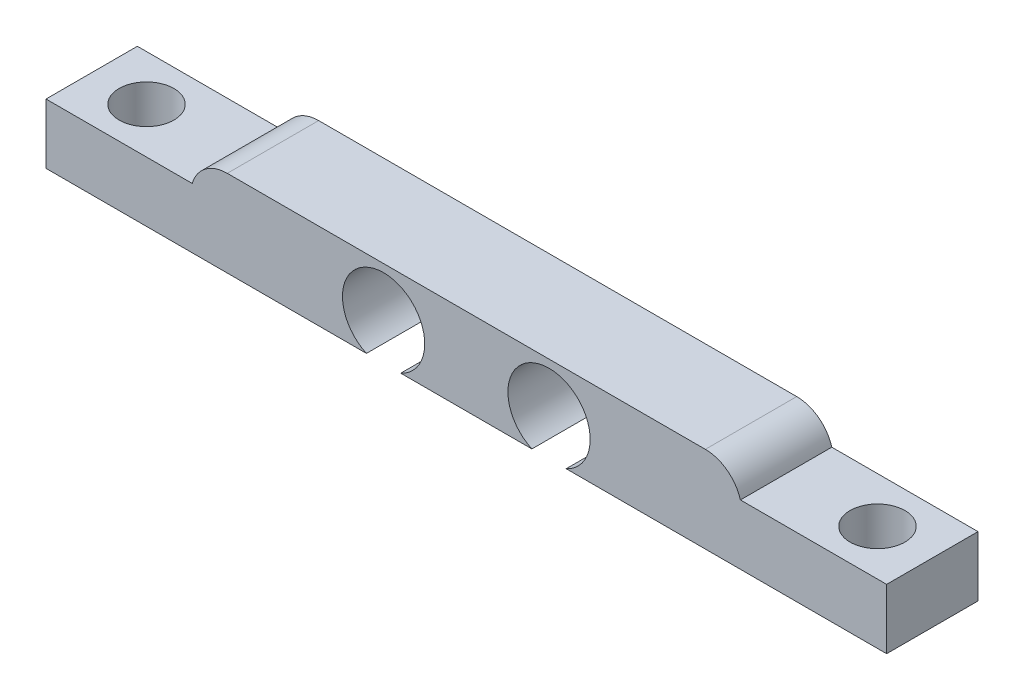
from build123d import *

# Parameters (mm, degrees)
BOSS_EXTRUDE1_DEPTH     = 5
FILLET1_R               = 2
CUT_EXTRUDE1_DEPTH      = 34.538204198
CUT_EXTRUDE1_DEPTH_BACK = 34.538204198
SKETCH2_R               = 1.5
CUT_EXTRUDE2_DEPTH      = 34.709745494
CUT_EXTRUDE2_DEPTH_BACK = 34.709745494
SKETCH3_R               = 2.25


with BuildPart() as part:
    # Sketch1 → Boss-Extrude1 (new body)
    with BuildSketch(Plane.XY):
        Polygon((-5, 4.727255151), (-5, 3.288029927), (-13, 3.288029927), (-13, 0), (33, 0), (33, 3.288029927), (25, 3.288029927), (25, 4.727255151), align=None)
    extrude(amount=-BOSS_EXTRUDE1_DEPTH)

    # Fillet1
    # the kernel refuses this fillet: 2 mm, written as the material it takes off along each edge
    with BuildSketch(Plane(origin=(-5, 4.727255151, 4.799434635), x_dir=(0, -1, 0), z_dir=(0, 0, -1))) as fillet1_piece_1:
        with BuildLine():
            CenterArc((2, -1.919773854), FILLET1_R, 106.283326604, 73.716673396)
            Line((0, -1.919773854), (-0.04, -1.919773854))
            Line((-0.04, -1.919773854), (-0.04, 0))
            Line((-0.04, 0), (0, 0.04))
            ThreePointArc((0, 0.04), (0.719612612, 0.04), (1.428009728, 0.038395477))
            Line((1.428009728, 0.038395477), (1.439225223, 0))
        make_face()
    extrude(amount=14.598869269, mode=Mode.SUBTRACT)
    with BuildSketch(Plane(origin=(25, 4.727255151, 4.799434635), x_dir=(0, -1, 0), z_dir=(0, 0, -1))) as fillet1_piece_2:
        with BuildLine():
            CenterArc((2, 1.919773854), FILLET1_R, 180, 73.716673396)
            Line((0, 1.919773854), (-0.04, 1.919773854))
            Line((-0.04, 1.919773854), (-0.04, 0))
            Line((-0.04, 0), (0, -0.04))
            ThreePointArc((0, -0.04), (0.719612612, -0.04), (1.428009728, -0.038395477))
            Line((1.428009728, -0.038395477), (1.439225223, 0))
        make_face()
    extrude(amount=14.598869269, mode=Mode.SUBTRACT)

    # Sketch2 → Cut-Extrude1 (cut, two sides: drawn at the far end of the back side and taken through both)
    with BuildSketch(Plane(origin=(0, 3.288029927, 0), x_dir=(1, 0, 0), z_dir=(0, 1, 0)).offset(-CUT_EXTRUDE1_DEPTH_BACK)):
        with Locations(Location((-10, 2.5, 0), (0, 0, 180))):
            Circle(SKETCH2_R)
        with Locations(Location((30, 2.5, 0), (0, 0, 180))):
            Circle(SKETCH2_R)
    extrude(amount=CUT_EXTRUDE1_DEPTH + CUT_EXTRUDE1_DEPTH_BACK, mode=Mode.SUBTRACT)

    # Sketch3 → Cut-Extrude2 (cut, two sides: drawn at the far end of the back side and taken through both)
    with BuildSketch(Plane.XY.offset(-CUT_EXTRUDE2_DEPTH_BACK)):
        with Locations((14.527125966, 2.045207178)):
            Circle(SKETCH3_R)
        with Locations((5.472874034, 2.045207178)):
            Circle(SKETCH3_R)
    extrude(amount=CUT_EXTRUDE2_DEPTH + CUT_EXTRUDE2_DEPTH_BACK, mode=Mode.SUBTRACT)


solid = part.part
